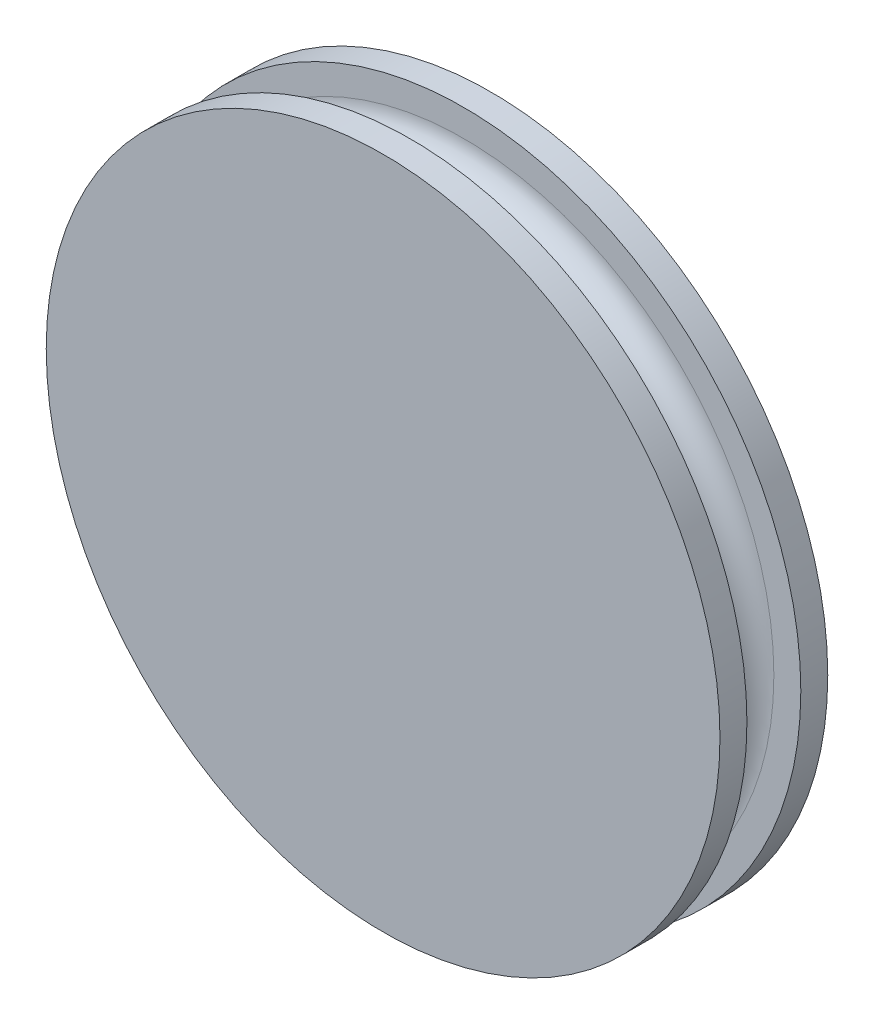
from build123d import *

# Parameters (mm, degrees)
SKETCH2_R               = 5.75
BOSS_EXTRUDE1_DEPTH     = 7.5
CUT_EXTRUDE1_DEPTH      = 2
CUT_EXTRUDE1_DEPTH_BACK = 13.879246872
SKETCH3_R               = 1.5
SKETCH4_R               = 62.5
BOSS_EXTRUDE2_DEPTH     = 5
SKETCH5_R               = 52.5
BOSS_EXTRUDE3_DEPTH     = 10
SKETCH6_R               = 62.5
BOSS_EXTRUDE4_DEPTH     = 5
FILLET2_R               = 5


with BuildPart() as part:
    # Sketch2 → Boss-Extrude1 (new body)
    with BuildSketch(Plane.XY):
        Circle(SKETCH2_R)
        with BuildLine():
            Line((-1.25, -3), (1.25, -3))
            ThreePointArc((1.25, -3), (0, 3.25), (-1.25, -3))
        make_face(mode=Mode.SUBTRACT)
    extrude(amount=BOSS_EXTRUDE1_DEPTH)

    # Sketch3 → Cut-Extrude1 (cut, two sides: drawn at the far end of the back side and taken through both)
    with BuildSketch(Plane(origin=(0, -3, 0), x_dir=(1, 0, 0), z_dir=(0, 1, 0)).offset(-CUT_EXTRUDE1_DEPTH_BACK)):
        with Locations(Location((0, -3.75, 0), (0, 0, 90))):
            Circle(SKETCH3_R)
    extrude(amount=CUT_EXTRUDE1_DEPTH + CUT_EXTRUDE1_DEPTH_BACK, mode=Mode.SUBTRACT)

    # Sketch4 → Boss-Extrude2 (add)
    with BuildSketch(Plane.XY.offset(7.5)):
        Circle(SKETCH4_R)
    extrude(amount=BOSS_EXTRUDE2_DEPTH)

    # Sketch5 → Boss-Extrude3 (add)
    with BuildSketch(Plane.XY.offset(12.5)):
        Circle(SKETCH5_R)
    extrude(amount=BOSS_EXTRUDE3_DEPTH)

    # Sketch6 → Boss-Extrude4 (add)
    with BuildSketch(Plane.XY.offset(22.5)):
        Circle(SKETCH6_R)
    extrude(amount=BOSS_EXTRUDE4_DEPTH)

    # Fillet2
    fillet2_edges = [part.edges().sort_by_distance(p)[0] for p in [
        (-52.5, 0, 12.5),
        (-52.5, 0, 22.5),
    ]]
    fillet(fillet2_edges, radius=FILLET2_R - 0.0001)  # a hair under: the kernel refuses the full size


solid = part.part
